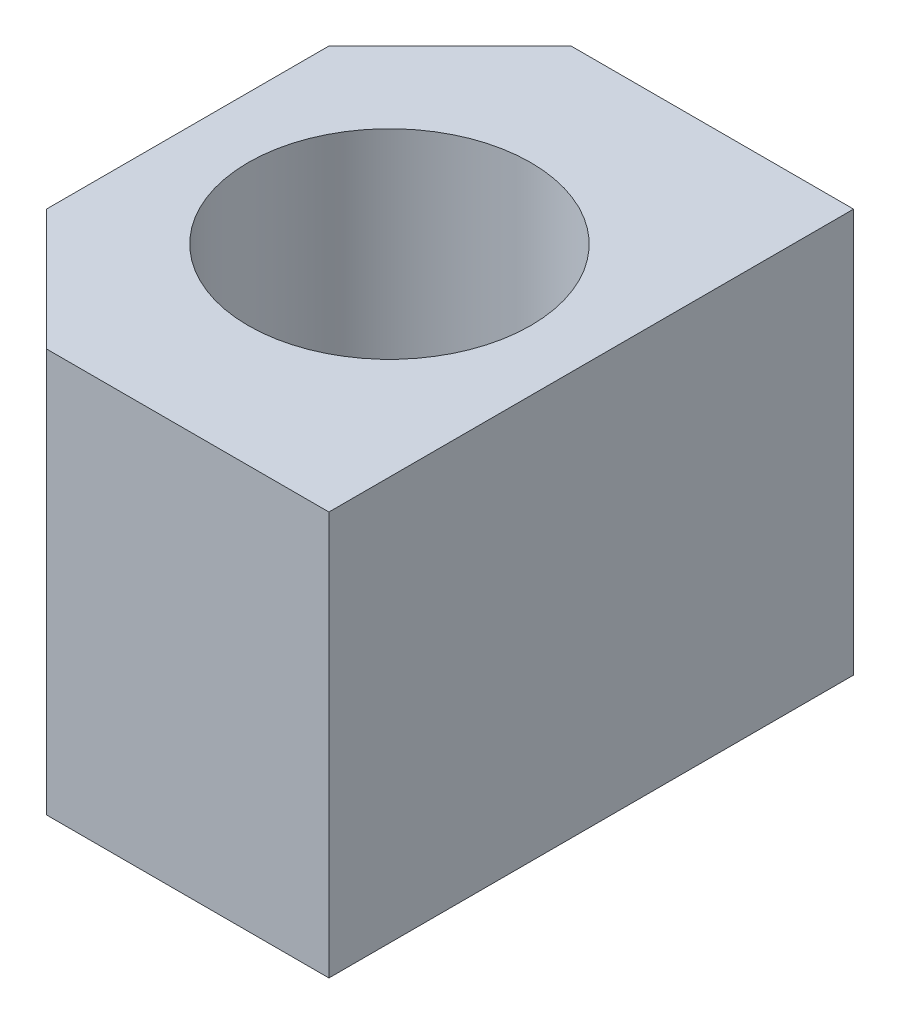
from build123d import *

# Parameters (mm, degrees)
SKETCH1_W               = 40
SKETCH1_H               = 52
BOSS_EXTRUDE1_DEPTH     = 40
CUT_EXTRUDE1_START      = -40
CUT_EXTRUDE1_DEPTH      = 40
CUT_EXTRUDE2_DEPTH      = 77.837490849
CUT_EXTRUDE2_DEPTH_BACK = 77.837490849
SKETCH8_R               = 14
CUT_EXTRUDE3_DEPTH      = 77.837490849


# Read off the part's stored shape, not the designer's step: Cut-Extrude1
with BuildPart() as part:
    # Sketch1 → Boss-Extrude1 (new body)
    with BuildSketch(Plane(origin=(0, 0, 0), x_dir=(1, 0, 0), z_dir=(0, 1, 0))):
        with Locations((20, 26)):
            Rectangle(SKETCH1_W, SKETCH1_H)
    extrude(amount=BOSS_EXTRUDE1_DEPTH)

    # Cut-Extrude1 outline → Cut-Extrude1 (cut)
    with BuildSketch(Plane(origin=(0, 40, 0), x_dir=(1, 0, 0), z_dir=(0, 1, 0)).offset(CUT_EXTRUDE1_START)):
        Polygon((0, 52), (0, 40), (12, 52), align=None)
    extrude(amount=CUT_EXTRUDE1_DEPTH, mode=Mode.SUBTRACT)

    # Sketch7 → Cut-Extrude2 (cut, two sides: drawn at the far end of the back side and taken through both)
    with BuildSketch(Plane(origin=(0, 40, 0), x_dir=(1, 0, 0), z_dir=(0, 1, 0)).offset(-CUT_EXTRUDE2_DEPTH_BACK)):
        Polygon((-90.593519883, 102.593519883), (0, 12), (12, 0), (102.593519883, -90.593519883), (-78.593519883, -271.780559649), (-271.780559649, -78.593519883), align=None)
    extrude(amount=CUT_EXTRUDE2_DEPTH + CUT_EXTRUDE2_DEPTH_BACK, mode=Mode.SUBTRACT)

    # Sketch8 → Cut-Extrude3 (cut, through all)
    with BuildSketch(Plane(origin=(0, 40, 0), x_dir=(1, 0, 0), z_dir=(0, 1, 0))):
        with Locations(Location((20, 26, 0), (0, 0, 270))):
            Circle(SKETCH8_R)
    extrude(amount=-CUT_EXTRUDE3_DEPTH, mode=Mode.SUBTRACT)


solid = part.part
